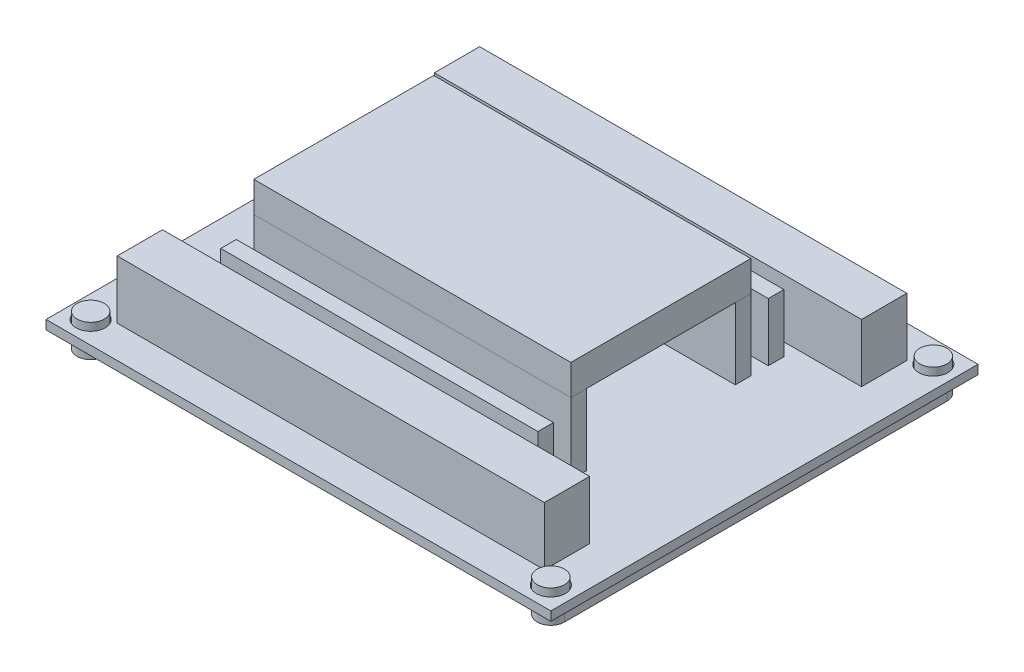
from build123d import *

# Parameters (mm, degrees)
SKETCH1_W             = 78
SKETCH1_H             = 66
BOSS_EXTRUDE1_DEPTH   = 1.4
SKETCH2_W             = 66
SKETCH2_H             = 7
SKETCH2_W_2           = 49
SKETCH2_H_2           = 2.4
BOSS_EXTRUDE2_DEPTH   = 9
SKETCH2_4_W           = 49
SKETCH2_4_H           = 2.4
BOSS_EXTRUDE3_DEPTH   = 11
SKETCH2_5_W           = 66
SKETCH2_5_H           = 7
SKETCH2_5_W_2         = 49
SKETCH2_5_H_2         = 2.4
BOSS_EXTRUDE6_DEPTH   = 2
SKETCH5_R             = 2.25
CUT_EXTRUDE1_DEPTH    = 2
SKETCH4_W             = 49
SKETCH4_H             = 27.8
ESP32_DEPTH           = 4.7
BOSS_EXTRUDE7_DEPTH   = 2.5
SKETCH6_3_R           = 2.1
BOSS_EXTRUDE8_DEPTH   = 2.5
BOSS_EXTRUDE8_2_DEPTH = 2.5
BOSS_EXTRUDE8_3_DEPTH = 2.5
BOSS_EXTRUDE8_4_DEPTH = 2.5


with BuildPart() as part:
    # Sketch1 → Boss-Extrude1 (new body)
    with BuildSketch(Plane(origin=(0, 0, 0), x_dir=(1, 0, 0), z_dir=(0, 1, 0))):
        with Locations((4.263157895, -18.263157895)):
            Rectangle(SKETCH1_W, SKETCH1_H)
    extrude(amount=BOSS_EXTRUDE1_DEPTH)

    # Sketch2 → Boss-Extrude2 (add)
    with BuildSketch(Plane(origin=(0, 1.4, 0), x_dir=(1, 0, 0), z_dir=(0, 1, 0))):
        with Locations((4.263157895, 6.236842105)):
            Rectangle(SKETCH2_W, SKETCH2_H)
        with Locations((4.263157895, -42.763157895)):
            Rectangle(SKETCH2_W, SKETCH2_H)
        with Locations((2.763157895, -36.063157895)):
            Rectangle(SKETCH2_W_2, SKETCH2_H_2)
        with Locations((2.763157895, -0.463157895)):
            Rectangle(SKETCH2_W_2, SKETCH2_H_2)
    extrude(amount=BOSS_EXTRUDE2_DEPTH)

    # Sketch2<4> → Boss-Extrude3 (add)
    with BuildSketch(Plane(origin=(0, 1.4, 0), x_dir=(1, 0, 0), z_dir=(0, 1, 0))):
        with Locations((2.763157895, -5.563157895)):
            Rectangle(SKETCH2_4_W, SKETCH2_4_H)
        with Locations((2.763157895, -30.963157895)):
            Rectangle(SKETCH2_4_W, SKETCH2_4_H)
    extrude(amount=BOSS_EXTRUDE3_DEPTH)

    # Sketch2<5> → Boss-Extrude6 (add)
    with BuildSketch(Plane(origin=(0, 1.4, 0), x_dir=(1, 0, 0), z_dir=(0, 1, 0))):
        with Locations((4.263157895, 6.236842105)):
            Rectangle(SKETCH2_5_W, SKETCH2_5_H)
        with Locations((4.263157895, -42.763157895)):
            Rectangle(SKETCH2_5_W, SKETCH2_5_H)
        with Locations((2.763157895, -36.063157895)):
            Rectangle(SKETCH2_5_W_2, SKETCH2_5_H_2)
        with Locations((2.763157895, -0.463157895)):
            Rectangle(SKETCH2_5_W_2, SKETCH2_5_H_2)
        with Locations((2.763157895, -5.563157895)):
            Rectangle(SKETCH2_5_W_2, SKETCH2_5_H_2)
        with Locations((2.763157895, -30.963157895)):
            Rectangle(SKETCH2_5_W_2, SKETCH2_5_H_2)
    extrude(amount=-BOSS_EXTRUDE6_DEPTH)

    # Sketch5 → Cut-Extrude1 (cut)
    with BuildSketch(Plane(origin=(0, 1.4, 0), x_dir=(1, 0, 0), z_dir=(0, 1, 0))):
        with Locations((-31.286842105, 11.286842105)):
            Circle(SKETCH5_R)
        with Locations((39.813157895, 11.286842105)):
            Circle(SKETCH5_R)
        with Locations((39.813157895, -47.813157895)):
            Circle(SKETCH5_R)
        with Locations((-31.286842105, -47.813157895)):
            Circle(SKETCH5_R)
    extrude(amount=-CUT_EXTRUDE1_DEPTH, mode=Mode.SUBTRACT)


with BuildPart() as body_2:
    # Sketch4 → ESP32 (new body)
    with BuildSketch(Plane(origin=(0, 12.4, 0), x_dir=(1, 0, 0), z_dir=(0, 1, 0))):
        with Locations((2.763157895, -18.263157895)):
            Rectangle(SKETCH4_W, SKETCH4_H)
    extrude(amount=ESP32_DEPTH)


with BuildPart() as body_3:
    # Sketch6 → Boss-Extrude7 (new body)
    with BuildSketch(Plane.XZ):
        with BuildLine():
            Line((-33.386842105, 47.813157895), (-33.386842105, -11.286842105))
            ThreePointArc((-33.386842105, -11.286842105), (-31.286842105, -13.386842105), (-29.186842105, -11.286842105))
            Line((-29.186842105, -11.286842105), (-29.186842105, 14.263157895))
            Line((-29.186842105, 14.263157895), (37.713157895, 14.263157895))
            Line((37.713157895, 14.263157895), (37.713157895, -11.286842105))
            ThreePointArc((37.713157895, -11.286842105), (39.813157895, -13.386842105), (41.913157895, -11.286842105))
            Line((41.913157895, -11.286842105), (41.913157895, 47.813157895))
            ThreePointArc((41.913157895, 47.813157895), (39.813157895, 49.913157895), (37.713157895, 47.813157895))
            Line((37.713157895, 47.813157895), (37.713157895, 22.263157895))
            Line((37.713157895, 22.263157895), (-29.186842105, 22.263157895))
            Line((-29.186842105, 22.263157895), (-29.186842105, 47.813157895))
            ThreePointArc((-29.186842105, 47.813157895), (-31.286842105, 49.913157895), (-33.386842105, 47.813157895))
        make_face()
    extrude(amount=BOSS_EXTRUDE7_DEPTH)


with BuildPart() as body_4:
    # Sketch6<3> → Boss-Extrude8 (new body)
    with BuildSketch(Plane.XZ):
        with Locations((-31.286842105, -11.286842105)):
            Circle(SKETCH6_3_R)
    extrude(amount=-BOSS_EXTRUDE8_DEPTH)


with BuildPart() as body_5:
    # Sketch6<3> → Boss-Extrude8 2 (new body)
    with BuildSketch(Plane.XZ):
        with Locations((39.813157895, -11.286842105)):
            Circle(SKETCH6_3_R)
    extrude(amount=-BOSS_EXTRUDE8_2_DEPTH)


with BuildPart() as body_6:
    # Sketch6<3> → Boss-Extrude8 3 (new body)
    with BuildSketch(Plane.XZ):
        with Locations((39.813157895, 47.813157895)):
            Circle(SKETCH6_3_R)
    extrude(amount=-BOSS_EXTRUDE8_3_DEPTH)


with BuildPart() as body_7:
    # Sketch6<3> → Boss-Extrude8 4 (new body)
    with BuildSketch(Plane.XZ):
        with Locations((-31.286842105, 47.813157895)):
            Circle(SKETCH6_3_R)
    extrude(amount=-BOSS_EXTRUDE8_4_DEPTH)


with BuildPart() as body_3_1:
    add(body_3.part)

    # Combine1: union body 7, body 4, body 5, body 6
    add(body_7.part)
    add(body_4.part)
    add(body_5.part)
    add(body_6.part)


solid = Compound([part.part, body_2.part, body_3_1.part])
